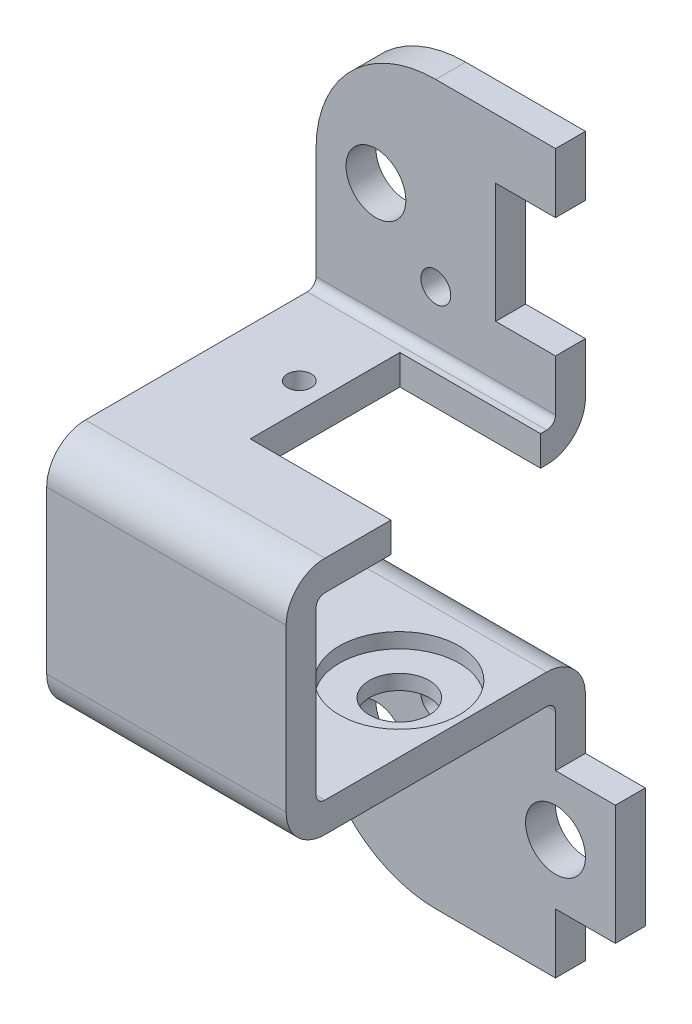
from build123d import *

# Parameters (mm, degrees)
SKETCH1_W           = 40
SKETCH1_H           = 60
SKETCH1_R           = 1.25
BASE_FLANGE1_DEPTH  = 2.5
SKETCH15_R          = 1
CUT_EXTRUDE3_DEPTH  = 10
JOG3_START          = -2.5
JOG3_OUTLINE_W      = 40
JOG3_OUTLINE_H      = 58.294687966
JOG3_OUTLINE_R      = 1
JOG3_OUTLINE_R_2    = 1.25
JOG3_DEPTH          = 2.5
JOG3_2_OUTLINE_W    = 40
JOG3_2_OUTLINE_H    = 1.705312034
JOG3_2_DEPTH        = 0.332528284
JOG3_START_2        = 19.2634
JOG3_3_OUTLINE_W    = 40
JOG3_3_OUTLINE_H    = 40
JOG3_3_OUTLINE_R    = 1
JOG3_3_OUTLINE_R_2  = 1.25
JOG3_3_DEPTH        = 3.2366
JOG3_4_OUTLINE_W    = 40
JOG3_4_OUTLINE_H    = 20.794687966
JOG3_4_OUTLINE_R    = 1.25
JOG3_4_DEPTH        = 3.2366
JOG3_5_OUTLINE_W    = 40
JOG3_5_OUTLINE_H    = 2.5
JOG3_5_DEPTH        = 20
JOG3_START_3        = 20
JOG3_6_OUTLINE_R    = 1.25
JOG3_6_OUTLINE_R_2  = 1
JOG3_6_DEPTH        = 2.5
JOG3_START_4        = -20
JOG3_7_DEPTH        = 40
JOG4_START          = -20
JOG4_DEPTH          = 40
JOG4_2_DEPTH        = 40
JOG4_START_2        = -3
JOG4_3_OUTLINE_R    = 1.25
JOG4_3_DEPTH        = 4
FILLET1_R           = 10
SKETCH18_R          = 2.5
BOSS_EXTRUDE1_DEPTH = 2.5
SKETCH19_R          = 1
SKETCH19_W          = 23.5
SKETCH19_H          = 12.5
CUT_EXTRUDE4_DEPTH  = 2.5
SKETCH20_R          = 2.5
CUT_EXTRUDE6_DEPTH  = 10
SKETCH23_R          = 2.5
CUT_EXTRUDE7_DEPTH  = 51.062460986
SKETCH24_R          = 5
CUT_EXTRUDE8_DEPTH  = 1.25
SKETCH26_R          = 2.5
CUT_EXTRUDE12_DEPTH = 51.062460987
SKETCH27_W          = 20
SKETCH27_H          = 13.5268
CUT_EXTRUDE13_DEPTH = 61.042487703


with BuildPart() as part:
    # Base-Flange1: sheet metal written as solids
    # Sketch1 → Base-Flange1 (new body)
    with BuildSketch(Plane.XY):
        Rectangle(SKETCH1_W, SKETCH1_H)
        with Locations((10, 15)):
            Circle(SKETCH1_R, mode=Mode.SUBTRACT)
        with Locations(Location((10, -15, 0), (0, 0, 180))):
            Circle(SKETCH1_R, mode=Mode.SUBTRACT)
        with Locations((-10, -15)):
            Circle(SKETCH1_R, mode=Mode.SUBTRACT)
        with Locations(Location((-10, 15, 0), (0, 0, 180))):
            Circle(SKETCH1_R, mode=Mode.SUBTRACT)
    extrude(amount=-BASE_FLANGE1_DEPTH)

    # Sketch15 → Cut-Extrude3 (cut)
    with BuildSketch(Plane.XY):
        with Locations((12, 0)):
            Circle(SKETCH15_R)
        with Locations(Location((-17, 0, 0), (0, 0, 180))):
            Circle(SKETCH15_R)
    extrude(amount=-CUT_EXTRUDE3_DEPTH, mode=Mode.SUBTRACT)

    # Jog3: read off the stored shape, not the designer's step
    # Jog3 outline → Jog3 (cut)
    with BuildSketch(Plane.XY.offset(JOG3_START)):
        with Locations((0, -0.852656017)):
            Rectangle(JOG3_OUTLINE_W, JOG3_OUTLINE_H)
        with Locations((-17, 0)):
            Circle(JOG3_OUTLINE_R, mode=Mode.SUBTRACT)
        with Locations((12, 0)):
            Circle(JOG3_OUTLINE_R, mode=Mode.SUBTRACT)
        with Locations((-10, 15)):
            Circle(JOG3_OUTLINE_R_2, mode=Mode.SUBTRACT)
        with Locations((10, 15)):
            Circle(JOG3_OUTLINE_R_2, mode=Mode.SUBTRACT)
        with Locations((10, -15)):
            Circle(JOG3_OUTLINE_R_2, mode=Mode.SUBTRACT)
        with Locations((-10, -15)):
            Circle(JOG3_OUTLINE_R_2, mode=Mode.SUBTRACT)
    extrude(amount=JOG3_DEPTH, mode=Mode.SUBTRACT)

    # Jog3 2 outline → Jog3 2 (cut)
    with BuildSketch(Plane.XY.offset(JOG3_START)):
        with Locations((0, 29.147343983)):
            Rectangle(JOG3_2_OUTLINE_W, JOG3_2_OUTLINE_H)
    extrude(amount=JOG3_2_DEPTH, mode=Mode.SUBTRACT)

    # Jog3 4 outline → Jog3 4 (add)
    with BuildSketch(Plane.XY.offset(JOG3_START)):
        with Locations((0, 40.397343983)):
            Rectangle(JOG3_4_OUTLINE_W, JOG3_4_OUTLINE_H)
        with Locations((10, 35.794687966)):
            Circle(JOG3_4_OUTLINE_R, mode=Mode.SUBTRACT)
        with Locations((-10, 35.794687966)):
            Circle(JOG3_4_OUTLINE_R, mode=Mode.SUBTRACT)
    extrude(amount=JOG3_4_DEPTH)



with BuildPart() as body_2:
    # Jog3 3 outline → Jog3 3 (new body)
    with BuildSketch(Plane.XY.offset(JOG3_START_2)):
        with Locations((0, 10.794687966)):
            Rectangle(JOG3_3_OUTLINE_W, JOG3_3_OUTLINE_H)
        with Locations((12, 20.794687966)):
            Circle(JOG3_3_OUTLINE_R, mode=Mode.SUBTRACT)
        with Locations((-17, 0)):
            Circle(JOG3_3_OUTLINE_R, mode=Mode.SUBTRACT)
        with Locations((-10, 5.794687966)):
            Circle(JOG3_3_OUTLINE_R_2, mode=Mode.SUBTRACT)
        with Locations((12, 0)):
            Circle(JOG3_3_OUTLINE_R, mode=Mode.SUBTRACT)
        with Locations((10, 5.794687966)):
            Circle(JOG3_3_OUTLINE_R_2, mode=Mode.SUBTRACT)
        with Locations((-17, 20.794687966)):
            Circle(JOG3_3_OUTLINE_R, mode=Mode.SUBTRACT)
        with Locations((-10, 15)):
            Circle(JOG3_3_OUTLINE_R_2, mode=Mode.SUBTRACT)
        with Locations((10, 15)):
            Circle(JOG3_3_OUTLINE_R_2, mode=Mode.SUBTRACT)
    extrude(amount=JOG3_3_DEPTH)


with BuildPart() as part_1:
    add(part.part)

    add(body_2.part)  # Jog3 5 merges body 2
    # Jog3 5 outline → Jog3 5 (add)
    with BuildSketch(Plane.XY):
        with Locations((0, 29.544687966)):
            Rectangle(JOG3_5_OUTLINE_W, JOG3_5_OUTLINE_H)
    extrude(amount=JOG3_5_DEPTH)

    # Jog3 6 outline → Jog3 6 (add)
    with BuildSketch(Plane.XY.offset(JOG3_START_3)):
        with Locations((10, 15)):
            Circle(JOG3_6_OUTLINE_R)
        with Locations((-10, 15)):
            Circle(JOG3_6_OUTLINE_R)
        with Locations((12, 0)):
            Circle(JOG3_6_OUTLINE_R_2)
        with Locations((-17, 0)):
            Circle(JOG3_6_OUTLINE_R_2)
    extrude(amount=JOG3_6_DEPTH)

    # Jog3 7 outline → Jog3 7 (cut)
    with BuildSketch(Plane.YZ.offset(JOG3_START_4)):
        with BuildLine():
            ThreePointArc((28.294687966, 19.2634), (28.078942821, 19.784254855), (27.558087966, 20))
            Line((27.558087966, 20), (-9.205312034, 20))
            Line((-9.205312034, 20), (-9.205312034, 19.2634))
            Line((-9.205312034, 19.2634), (28.294687966, 19.2634))
        make_face()
        with BuildLine():
            ThreePointArc((31.531287966, -2.5), (29.242666158, -1.552021808), (28.294687966, 0.7366))
            Line((28.294687966, 0.7366), (28.294687966, -2.167471716))
            Line((28.294687966, -2.167471716), (30, -2.167471716))
            Line((30, -2.167471716), (30, -2.5))
            Line((30, -2.5), (31.531287966, -2.5))
        make_face()
        with BuildLine():
            Line((31.531287966, 0), (50.794687966, 0))
            Line((50.794687966, 0), (50.794687966, 0.7366))
            Line((50.794687966, 0.7366), (30.794687966, 0.7366))
            ThreePointArc((30.794687966, 0.7366), (31.010433111, 0.215745145), (31.531287966, 0))
        make_face()
        with BuildLine():
            Line((30.794687966, 22.5), (27.558087966, 22.5))
            ThreePointArc((27.558087966, 22.5), (29.846709774, 21.552021808), (30.794687966, 19.2634))
            Line((30.794687966, 19.2634), (30.794687966, 22.5))
        make_face()
    extrude(amount=JOG3_7_DEPTH, mode=Mode.SUBTRACT)

    # Jog4: read off the stored shape, not the designer's step
    # Jog4 outline → Jog4 (cut)
    with BuildSketch(Plane.YZ.offset(JOG4_START)):
        with BuildLine():
            Line((-9.205312034, 20), (10.87962174, 20))
            ThreePointArc((10.87962174, 20), (12.019882984, 21.799110859), (14.031287966, 22.5))
            Line((14.031287966, 22.5), (-9.205312034, 22.5))
            Line((-9.205312034, 22.5), (-9.205312034, 20))
        make_face()
    extrude(amount=JOG4_DEPTH, mode=Mode.SUBTRACT)

    # Jog4 2 outline → Jog4 2 (add)
    with BuildSketch(Plane.YZ.offset(JOG4_START)):
        with BuildLine():
            Line((-9.205312034, 0), (-9.205312034, -2.5))
            Line((-9.205312034, -2.5), (10.058087966, -2.5))
            ThreePointArc((10.058087966, -2.5), (12.346709774, -1.552021808), (13.294687966, 0.7366))
            Line((13.294687966, 0.7366), (13.294687966, 19.2634))
            ThreePointArc((13.294687966, 19.2634), (13.510433111, 19.784254855), (14.031287966, 20))
            Line((14.031287966, 20), (10.87962174, 20))
            ThreePointArc((10.87962174, 20), (10.81599152, 19.634140241), (10.794687966, 19.2634))
            Line((10.794687966, 19.2634), (10.794687966, 0.7366))
            ThreePointArc((10.794687966, 0.7366), (10.578942821, 0.215745145), (10.058087966, 0))
            Line((10.058087966, 0), (-9.205312034, 0))
        make_face()
    extrude(amount=JOG4_2_DEPTH)

    # Jog4 3 outline → Jog4 3 (cut)
    with BuildSketch(Plane.XY.offset(JOG4_START_2)):
        with Locations((-10, 5.794687966)):
            Circle(JOG4_3_OUTLINE_R)
        with Locations((10, 5.794687966)):
            Circle(JOG4_3_OUTLINE_R)
    extrude(amount=JOG4_3_DEPTH, mode=Mode.SUBTRACT)

    # Fillet1
    fillet1_edges = [part_1.edges().sort_by_distance(p)[0] for p in [
        (20, -9.205312034, -1.25),
        (-20, -9.205312034, -1.25),
        (-20, 50.794687966, -1.25),
        (20, 50.794687966, -1.25),
    ]]
    fillet(fillet1_edges, radius=FILLET1_R)

    # Sketch18 → Boss-Extrude1 (add)
    with BuildSketch(Plane.XY.offset(22.5)):
        with Locations((12, 20.794687966)):
            Circle(SKETCH18_R)
        with Locations((-17, 20.794687966)):
            Circle(SKETCH18_R)
    extrude(amount=-BOSS_EXTRUDE1_DEPTH)

    # Sketch19 → Cut-Extrude4 (cut)
    with BuildSketch(Plane(origin=(0, 30.794687966, 0), x_dir=(1, 0, 0), z_dir=(0, 1, 0))):
        with Locations(Location((13.9, -7.5, 0), (0, 0, 270))):
            Circle(SKETCH19_R)
        with Locations(Location((-13.9, -7.5, 0), (0, 0, 90))):
            Circle(SKETCH19_R)
        with Locations((0, -7.5)):
            Rectangle(SKETCH19_W, SKETCH19_H)
    extrude(amount=-CUT_EXTRUDE4_DEPTH, mode=Mode.SUBTRACT)

    # Sketch20 → Cut-Extrude6 (cut)
    with BuildSketch(Plane.XY):
        with Locations((0, 40.794687966)):
            Circle(SKETCH20_R)
        with Locations(Location((0, 0.794687966, 0), (0, 0, 180))):
            Circle(SKETCH20_R)
        with Locations((15, 0.794687966)):
            Circle(SKETCH20_R)
        with Locations(Location((-15, 0.794687966, 0), (0, 0, 180))):
            Circle(SKETCH20_R)
        with Locations(Location((15, 40.794687966, 0), (0, 0, 180))):
            Circle(SKETCH20_R)
        with Locations((-15, 40.794687966)):
            Circle(SKETCH20_R)
    extrude(amount=-CUT_EXTRUDE6_DEPTH, mode=Mode.SUBTRACT)

    # Sketch23 → Cut-Extrude7 (cut, through all)
    with BuildSketch(Plane(origin=(0, 30.794687966, 0), x_dir=(1, 0, 0), z_dir=(0, 1, 0))):
        with Locations(Location((-5.55, -7.5, 0), (0, 0, 270))):
            Circle(SKETCH23_R)
    extrude(amount=-CUT_EXTRUDE7_DEPTH, mode=Mode.SUBTRACT)

    # Sketch24 → Cut-Extrude8 (cut)
    with BuildSketch(Plane(origin=(0, 13.294687966, 0), x_dir=(1, 0, 0), z_dir=(0, 1, 0))):
        with Locations(Location((-5.55, -7.5, 0), (0, 0, 270))):
            Circle(SKETCH24_R)
    extrude(amount=-CUT_EXTRUDE8_DEPTH, mode=Mode.SUBTRACT)

    # Sketch26 → Cut-Extrude12 (cut, through all)
    with BuildSketch(Plane.XZ.offset(-10.794687966)):
        with Locations(Location((9.45, 17.5, 0), (0, 0, 135.141364755))):
            Circle(SKETCH26_R)
    extrude(amount=-CUT_EXTRUDE12_DEPTH, mode=Mode.SUBTRACT)

    # Sketch27 → Cut-Extrude13 (cut, through all)
    with BuildSketch(Plane.XY.offset(22.5)):
        Polygon((20, 50.794687966), (0, 50.794687966), (0, 45.794687966), (-5, 45.794687966), (-5, 35.794687966), (0, 35.794687966), (0, 27.558087966), (20, 27.558087966), align=None)
        with Locations((10, 20.794687966)):
            Rectangle(SKETCH27_W, SKETCH27_H)
        Polygon((20, -9.205312034), (20, 14.031287966), (0, 14.031287966), (0, 5.794687966), (5, 5.794687966), (5, -4.205312034), (0, -4.205312034), (0, -9.205312034), align=None)
    extrude(amount=-CUT_EXTRUDE13_DEPTH, mode=Mode.SUBTRACT)


solid = part_1.part
